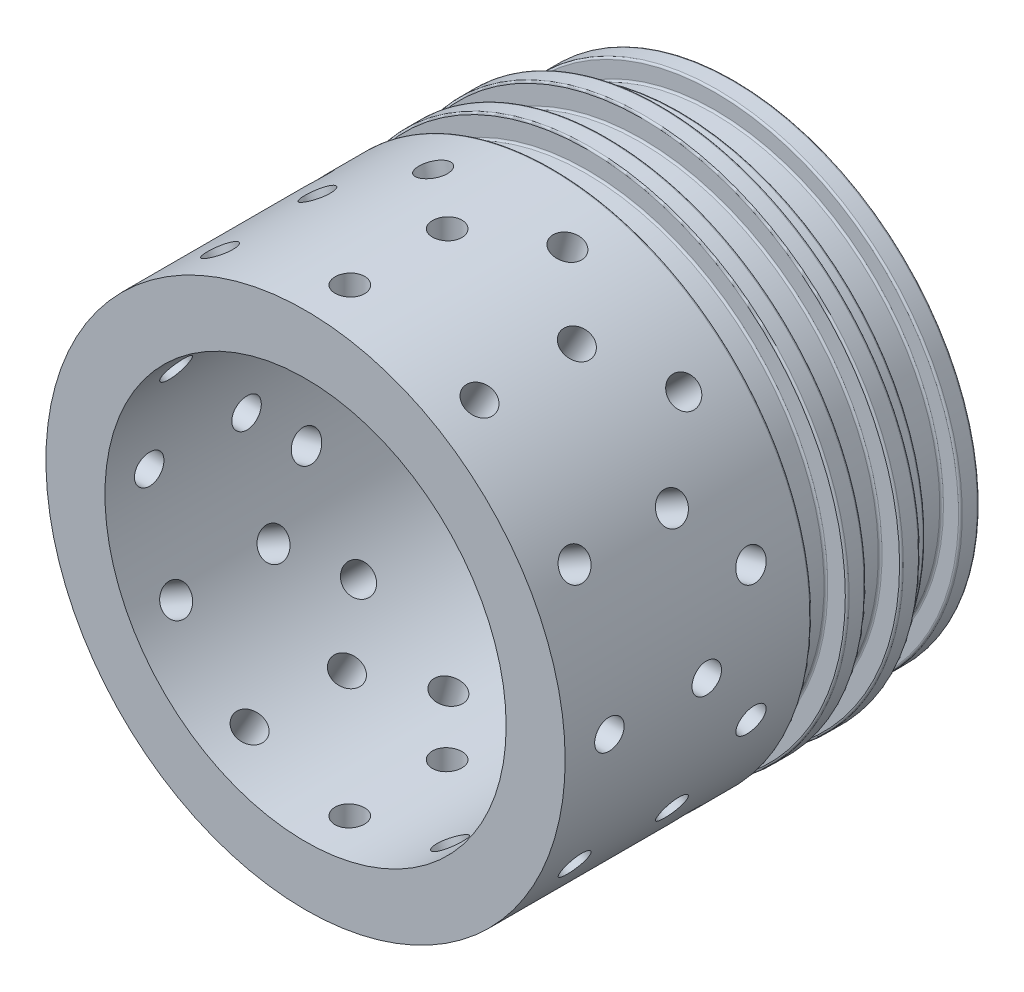
from build123d import *
from build123d.topology import SkipClean

# Parameters (mm, degrees)
SKETCH5_R           = 19.05
SKETCH5_R_2         = 3.81
BOSS_EXTRUDE1_DEPTH = 50.8
SKETCH5_2_R         = 3.81
CUT_EXTRUDE1_DEPTH  = 50.8
FILLET1_R           = 5.08
SKETCH7_R           = 3.96875
CUT_EXTRUDE2_DEPTH  = 135.608018335
SKETCH8_R           = 3.96875
CUT_EXTRUDE3_DEPTH  = 135.608018511
CIRPATTERN1_COUNT   = 12
FILLET2_R           = 0.508
BOSS_EXTRUDE2_START = 23.8125
SKETCH9_R           = 69.85
SKETCH9_R_2         = 53.975
BOSS_EXTRUDE2_DEPTH = 23.8125
SKETCH10_R          = 3.96875
CUT_EXTRUDE4_DEPTH  = 152.793227149
CIRPATTERN2_COUNT   = 12


with BuildPart() as part:
    # Sketch3 → Revolve1 (revolve)
    with BuildSketch(Plane(origin=(0, 0, 0), x_dir=(0, 0, -1), z_dir=(1, 0, 0))):
        Polygon((0, 0), (0, 66.0146), (-5.08, 66.0146), (-5.08, 60.96), (-14.605, 60.96), (-14.605, 66.0146), (-19.685, 66.0146), (-19.685, 69.85), (-24.765, 69.85), (-24.765, 64.1096), (-34.29, 64.1096), (-34.29, 69.85), (-39.37, 69.85), (-39.37, 64.1096), (-48.895, 64.1096), (-48.895, 69.85), (-91.44, 69.85), (-91.44, 53.975), (-6.35, 53.975), (-6.35, 0), align=None)
    revolve(axis=Axis((0, 0, 6.35), (0, 0, -1)))

    # Sketch5 → Boss-Extrude1 (add)
    with BuildSketch(Plane(origin=(0, 0, 0), x_dir=(-1, 0, 0), z_dir=(0, 0, -1))):
        Circle(SKETCH5_R)
        Circle(SKETCH5_R_2, mode=Mode.SUBTRACT)
    extrude(amount=-BOSS_EXTRUDE1_DEPTH)

    # Sketch5<2> → Cut-Extrude1 (cut)
    with BuildSketch(Plane(origin=(0, 0, 0), x_dir=(-1, 0, 0), z_dir=(0, 0, -1))):
        Circle(SKETCH5_2_R)
    extrude(amount=-CUT_EXTRUDE1_DEPTH, mode=Mode.SUBTRACT)

    # Fillet1
    fillet1_edges = [part.edges().sort_by_distance(p)[0] for p in [
        (0, -53.975, 6.35),
        (19.05, 0, 6.35),
    ]]
    fillet(fillet1_edges, radius=FILLET1_R)

    # Sketch7 → Cut-Extrude2 (cut, through all)
    with BuildSketch(Plane(origin=(0, 0, 0), x_dir=(0, 0, -1), z_dir=(1, 0, 0))):
        with Locations((-77.1525, 0)):
            Circle(SKETCH7_R)
    cut_extrude2 = extrude(amount=CUT_EXTRUDE2_DEPTH, mode=Mode.SUBTRACT)

    # Sketch8 → Cut-Extrude3 (cut, through all)
    with BuildSketch(Plane(origin=(0, 0, 0), x_dir=(0, 0, -1), z_dir=(0.9659258262890681, -0.25881904510252135, 0))):
        with Locations((-62.865, 0)):
            Circle(SKETCH8_R)
    cut_extrude3 = extrude(amount=CUT_EXTRUDE3_DEPTH, mode=Mode.SUBTRACT)

    # CirPattern1: Cut-Extrude2, Cut-Extrude3 ×12 about axis
    cirpattern1_axis = Axis((0, 0, 82.144110027), (0, 0, -1))
    add([cut_extrude2.rotate(cirpattern1_axis, i * 360 / CIRPATTERN1_COUNT) for i in range(1, CIRPATTERN1_COUNT)], mode=Mode.SUBTRACT)
    add([cut_extrude3.rotate(cirpattern1_axis, i * 360 / CIRPATTERN1_COUNT) for i in range(1, CIRPATTERN1_COUNT)], mode=Mode.SUBTRACT)

    # Fillet2
    fillet2_edges = [part.edges().sort_by_distance(p)[0] for p in [
        (0, -66.0146, 5.08),
        (0, -60.96, 5.08),
        (0, -60.96, 14.605),
        (0, -66.0146, 14.605),
        (0, -69.85, 24.765),
        (0, -64.1096, 24.765),
        (0, -64.1096, 34.29),
        (0, -69.85, 34.29),
        (0, -69.85, 39.37),
        (0, -64.1096, 39.37),
        (0, -64.1096, 48.895),
        (0, -69.85, 48.895),
        (0, -66.0146, 0),
        (0, -69.85, 19.685),
    ]]
    fillet(fillet2_edges, radius=FILLET2_R)

    # Sketch9 → Boss-Extrude2 (add)
    with BuildSketch(Plane.XY.offset(91.44).offset(BOSS_EXTRUDE2_START)):
        Circle(SKETCH9_R)
        Circle(SKETCH9_R_2, mode=Mode.SUBTRACT)
    extrude(amount=-BOSS_EXTRUDE2_DEPTH)

    # Sketch10 → Cut-Extrude4 (cut, through all)
    with BuildSketch(Plane(origin=(0, 0, 0), x_dir=(0, 0, -1), z_dir=(1, 0, 0))):
        with Locations((-103.34625, 0)):
            Circle(SKETCH10_R)
    cut_extrude4 = extrude(amount=CUT_EXTRUDE4_DEPTH, mode=Mode.SUBTRACT)

    # CirPattern2: Cut-Extrude4 ×12 about axis
    with SkipClean():  # the faces are left unmerged after this step: merging them gives an invalid solid
        cirpattern2_axis = Axis((0, 0, 82.144110027), (0, 0, -1))
        for i in range(1, CIRPATTERN2_COUNT):
            add(cut_extrude4.rotate(cirpattern2_axis, i * 360 / CIRPATTERN2_COUNT), mode=Mode.SUBTRACT)


solid = part.part
